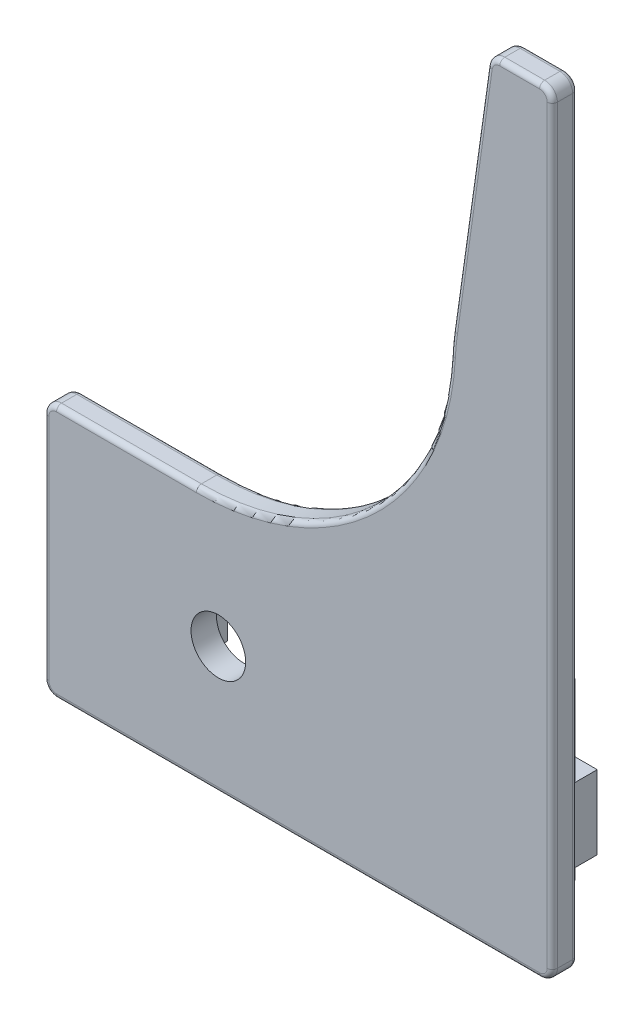
from build123d import *

# Parameters (mm, degrees)
SKETCH_1_R          = 2.15
EXTRUDE_1_DEPTH     = 2
SKETCH_2_W          = 23.301883536
SKETCH_2_H          = 5.8
SKETCH_2_W_2        = 10.898116464
EXTRUDE_2_DEPTH     = 1.6
FILLET_1_R          = 1
CHAMFER_START       = -66
CHAMFER_1_OUTLINE_W = 25
CHAMFER_1_OUTLINE_H = 4
CHAMFER_1_DEPTH     = 4.467828672
FILLET_2_R          = 1
FILLET_3_R          = 20
FILLET_5_R          = 0.4
FILLET_6_R          = 0.4


with BuildPart() as part:
    # 草图1 → 凸台-拉伸1 (new body)
    with BuildSketch(Plane.XY):
        with BuildLine():
            Line((-61.382701422, 26.657582938), (-53.382701422, 26.657582938))
            Line((-53.382701422, 26.657582938), (-53.382701422, -34.342417062))
            Line((-53.382701422, -34.342417062), (-61.382701422, -34.342417062))
            Line((-61.382701422, -34.342417062), (-93.382701422, -34.342417062))
            Line((-93.382701422, -34.342417062), (-93.382701422, -14.342417062))
            Line((-93.382701422, -14.342417062), (-81.382701422, -14.342417062))
            ThreePointArc((-81.382701422, -14.342417062), (-67.240565798, -8.484552685), (-61.382701422, 5.657582938))
            Line((-61.382701422, 5.657582938), (-61.382701422, 26.657582938))
        make_face()
        with Locations((-79.650533319, -24.342417062)):
            Circle(SKETCH_1_R, mode=Mode.SUBTRACT)
    extrude(amount=EXTRUDE_1_DEPTH)

    # 草图2 → 凸台-拉伸2 (add)
    with BuildSketch(Plane(origin=(0, 0, 0), x_dir=(-1, 0, 0), z_dir=(0, 0, -1))):
        with Locations((65.099591551, -24.342417062)):
            Rectangle(SKETCH_2_W, SKETCH_2_H)
        with Locations((87.999591551, -24.342417062)):
            Rectangle(SKETCH_2_W_2, SKETCH_2_H)
    extrude(amount=EXTRUDE_2_DEPTH)

    # 圆角1
    fillet_1_edges = [part.edges().sort_by_distance(p)[0] for p in [
        (-53.382701422, 26.657582938, 1),
        (-53.382701422, -34.342417062, 1),
        (-93.382701422, -34.342417062, 1),
        (-93.382701422, -14.342417062, 1),
    ]]
    fillet(fillet_1_edges, radius=FILLET_1_R)

    # 倒角1: read off the stored shape, not the designer's step
    # 倒角1 outline → 倒角1 (cut)
    with BuildSketch(Plane(origin=(0, 0, 0), x_dir=(0.13944684527210205, 0.9902295579024383, 0), z_dir=(0.9902295579024384, -0.13944684527210205, 0)).offset(CHAMFER_START)):
        with Locations((7.5, 1)):
            Rectangle(CHAMFER_1_OUTLINE_W, CHAMFER_1_OUTLINE_H)
    extrude(amount=CHAMFER_1_DEPTH, mode=Mode.SUBTRACT)

    # 圆角2
    fillet_2_edges = [part.edges().sort_by_distance(p)[0] for p in [
        (-58.385305734, 26.657582938, 1),
    ]]
    fillet(fillet_2_edges, radius=FILLET_2_R)

    # 圆角3
    fillet_3_edges = [part.edges().sort_by_distance(p)[0] for p in [
        (-61.384966041, 5.356618447, 1),
    ]]
    fillet(fillet_3_edges, radius=FILLET_3_R)

    # 圆角5
    # the kernel refuses this fillet: 0.4 mm, written as the material it takes off along each edge
    with BuildSketch(Plane(origin=(-93.382701422, -21.442417062, 0), x_dir=(1, 0, 0), z_dir=(0, 1, 0)), Plane(origin=(-93.382701422, -33.342417062, 0), x_dir=(1, 0, 0), z_dir=(0, 1, 0))) as fillet_5_piece_1:
        with BuildLine():
            CenterArc((FILLET_5_R, -FILLET_5_R), FILLET_5_R, 90, 90)
            Line((0, -FILLET_5_R), (0, 0))
            Line((0, 0), (FILLET_5_R, 0))
        make_face()
    extrude(amount=6.1, mode=Mode.SUBTRACT)
    with BuildSketch(Plane(origin=(-92.382701422, -15.342417062, 0), x_dir=(0, 1, 0), z_dir=(1, 0, 0))) as fillet_5_piece_2:
        with BuildLine():
            CenterArc((1 - FILLET_5_R, FILLET_5_R), FILLET_5_R, 270, 90)
            Line((1, FILLET_5_R), (1, 0))
            Line((1, 0), (1 - FILLET_5_R, 0))
        make_face()
    revolve(axis=Axis((-92.382701422, -15.342417062, 0), (0, 0, 1)), revolution_arc=90, mode=Mode.SUBTRACT)
    with BuildSketch(Plane(origin=(-92.382701422, -14.342417062, 0), x_dir=(0, -1, 0), z_dir=(1, 0, 0))) as fillet_5_piece_3:
        with BuildLine():
            CenterArc((FILLET_5_R, -FILLET_5_R), FILLET_5_R, 90, 90)
            Line((0, -FILLET_5_R), (0, 0))
            Line((0, 0), (FILLET_5_R, 0))
        make_face()
    extrude(amount=11, mode=Mode.SUBTRACT)
    with BuildSketch(Plane(origin=(-81.382701422, 5.657582938, 0), x_dir=(0, -1, 0), z_dir=(-1, 0, 0))) as fillet_5_piece_4:
        with BuildLine():
            CenterArc((20 + FILLET_5_R, FILLET_5_R), FILLET_5_R, 180, 90)
            Line((20, FILLET_5_R), (20, 0))
            Line((20, 0), (20 + FILLET_5_R, 0))
        make_face()
    revolve(axis=Axis((-81.382701422, 5.657582938, 0), (0, 0, 1)), revolution_arc=87.040880974, mode=Mode.SUBTRACT)
    with BuildSketch(Plane(origin=(-92.382701422, -33.342417062, 0), x_dir=(-1, 0, 0), z_dir=(0, 1, 0))) as fillet_5_piece_5:
        with BuildLine():
            CenterArc((1 - FILLET_5_R, FILLET_5_R), FILLET_5_R, 270, 90)
            Line((1, FILLET_5_R), (1, 0))
            Line((1, 0), (1 - FILLET_5_R, 0))
        make_face()
    revolve(axis=Axis((-92.382701422, -33.342417062, 0), (0, 0, 1)), revolution_arc=90, mode=Mode.SUBTRACT)
    with BuildSketch(Plane(origin=(-92.382701422, -34.342417062, 0), x_dir=(0, 1, 0), z_dir=(1, 0, 0))) as fillet_5_piece_6:
        with BuildLine():
            CenterArc((FILLET_5_R, FILLET_5_R), FILLET_5_R, 180, 90)
            Line((0, FILLET_5_R), (0, 0))
            Line((0, 0), (FILLET_5_R, 0))
        make_face()
    extrude(amount=38, mode=Mode.SUBTRACT)
    with BuildSketch(Plane(origin=(-54.382701422, -33.342417062, 0), x_dir=(0, -1, 0), z_dir=(-1, 0, 0))) as fillet_5_piece_7:
        with BuildLine():
            CenterArc((1 - FILLET_5_R, FILLET_5_R), FILLET_5_R, 270, 90)
            Line((1, FILLET_5_R), (1, 0))
            Line((1, 0), (1 - FILLET_5_R, 0))
        make_face()
    revolve(axis=Axis((-54.382701422, -33.342417062, 0), (0, 0, 1)), revolution_arc=90, mode=Mode.SUBTRACT)
    with BuildSketch(Plane(origin=(-53.382701422, 25.657582938, 0), x_dir=(-1, 0, 0), z_dir=(0, -1, 0))) as fillet_5_piece_8_section:
        with BuildLine():
            CenterArc((FILLET_5_R, -FILLET_5_R), FILLET_5_R, 90, 90)
            Line((0, -FILLET_5_R), (0, 0))
            Line((0, 0), (FILLET_5_R, 0))
        make_face()
    fillet_5_piece_8 = extrude(amount=59, mode=Mode.PRIVATE)
    fillet_5_piece_8 = split(fillet_5_piece_8, bisect_by=Plane(origin=(-53.382701422, -21.442417062, 0), z_dir=(0, 1, 0)), keep=Keep.TOP, mode=Mode.PRIVATE)
    add(fillet_5_piece_8, mode=Mode.SUBTRACT)
    with BuildSketch(Plane(origin=(-53.382701422, 25.657582938, 0), x_dir=(-1, 0, 0), z_dir=(0, -1, 0))) as fillet_5_piece_9_section:
        with BuildLine():
            CenterArc((FILLET_5_R, -FILLET_5_R), FILLET_5_R, 90, 90)
            Line((0, -FILLET_5_R), (0, 0))
            Line((0, 0), (FILLET_5_R, 0))
        make_face()
    fillet_5_piece_9 = extrude(amount=59, mode=Mode.PRIVATE)
    fillet_5_piece_9 = split(fillet_5_piece_9, bisect_by=Plane(origin=(-53.448649783, 25.657582938, 0), z_dir=(1, 0, 0)), keep=Keep.TOP, mode=Mode.PRIVATE)
    add(fillet_5_piece_9, mode=Mode.SUBTRACT)
    with BuildSketch(Plane(origin=(-53.382701422, 25.657582938, 0), x_dir=(-1, 0, 0), z_dir=(0, -1, 0))) as fillet_5_piece_10_section:
        with BuildLine():
            CenterArc((FILLET_5_R, -FILLET_5_R), FILLET_5_R, 90, 90)
            Line((0, -FILLET_5_R), (0, 0))
            Line((0, 0), (FILLET_5_R, 0))
        make_face()
    fillet_5_piece_10 = extrude(amount=59, mode=Mode.PRIVATE)
    fillet_5_piece_10 = split(fillet_5_piece_10, bisect_by=Plane(origin=(-53.382701422, -27.242417062, 0), z_dir=(0, -1, 0)), keep=Keep.TOP, mode=Mode.PRIVATE)
    add(fillet_5_piece_10, mode=Mode.SUBTRACT)
    with BuildSketch(Plane(origin=(-54.382701422, 25.657582938, 0), x_dir=(0, 1, 0), z_dir=(-1, 0, 0))) as fillet_5_piece_11:
        with BuildLine():
            CenterArc((1 - FILLET_5_R, -FILLET_5_R), FILLET_5_R, 0, 90)
            Line((1, -FILLET_5_R), (1, 0))
            Line((1, 0), (1 - FILLET_5_R, 0))
        make_face()
    revolve(axis=Axis((-54.382701422, 25.657582938, 0), (0, 0, -1)), revolution_arc=90, mode=Mode.SUBTRACT)
    with BuildSketch(Plane(origin=(-57.516261634, 26.657582938, 0), x_dir=(0, -1, 0), z_dir=(1, 0, 0))) as fillet_5_piece_12:
        with BuildLine():
            CenterArc((FILLET_5_R, -FILLET_5_R), FILLET_5_R, 90, 90)
            Line((0, -FILLET_5_R), (0, 0))
            Line((0, 0), (FILLET_5_R, 0))
        make_face()
    extrude(amount=3.133560212, mode=Mode.SUBTRACT)
    with BuildSketch(Plane(origin=(-57.516261634, 25.657582938, 0), x_dir=(0, 1, 0), z_dir=(1, 0, 0))) as fillet_5_piece_13:
        with BuildLine():
            CenterArc((1 - FILLET_5_R, FILLET_5_R), FILLET_5_R, 270, 90)
            Line((1, FILLET_5_R), (1, 0))
            Line((1, 0), (1 - FILLET_5_R, 0))
        make_face()
    revolve(axis=Axis((-57.516261634, 25.657582938, 0), (0, 0, 1)), revolution_arc=81.984161159, mode=Mode.SUBTRACT)
    with BuildSketch(Plane(origin=(-58.506491192, 25.797029784, 0), x_dir=(0.9902295579024384, -0.13944684527210205, 0), z_dir=(-0.13944684527210205, -0.9902295579024384, 0))) as fillet_5_piece_14:
        with BuildLine():
            CenterArc((FILLET_5_R, FILLET_5_R), FILLET_5_R, 180, 90)
            Line((0, FILLET_5_R), (0, 0))
            Line((0, 0), (FILLET_5_R, 0))
        make_face()
    extrude(amount=19.60701568, mode=Mode.SUBTRACT)
    with BuildSketch(Plane(origin=(-41.436036516, 3.592646409, 0), x_dir=(-0.9902295579024383, 0.13944684527210185, 0), z_dir=(0.13944684527210185, 0.9902295579024383, 0))) as fillet_5_piece_15:
        with BuildLine():
            CenterArc((20 - FILLET_5_R, FILLET_5_R), FILLET_5_R, 270, 90)
            Line((20, FILLET_5_R), (20, 0))
            Line((20, 0), (20 - FILLET_5_R, 0))
        make_face()
    revolve(axis=Axis((-41.436036516, 3.592646409, 0), (0, 0, 1)), revolution_arc=5.056719815, mode=Mode.SUBTRACT)

    # 圆角6
    fillet_6_edges = [part.edges().sort_by_distance(p)[0] for p in [
        (-86.882701422, -14.342417062, 2),
        (-55.949481528, 26.657582938, 2),
        (-53.382701422, -3.842417062, 2),
        (-93.382701422, -24.342417062, 2),
        (-73.382701422, -34.342417062, 2),
        (-93.089808203, -14.63531028, 2),
        (-93.089808203, -34.049523843, 2),
        (-53.675594641, -34.049523843, 2),
        (-53.675594641, 26.36468972, 2),
        (-59.873559433, 16.089306549, 2),
        (-58.172216341, 26.412383192, 2),
        (-67.610435183, -8.844992097, 2),
        (-61.344378918, 5.505210859, 2),
    ]]
    fillet(fillet_6_edges, radius=FILLET_6_R)


solid = part.part
